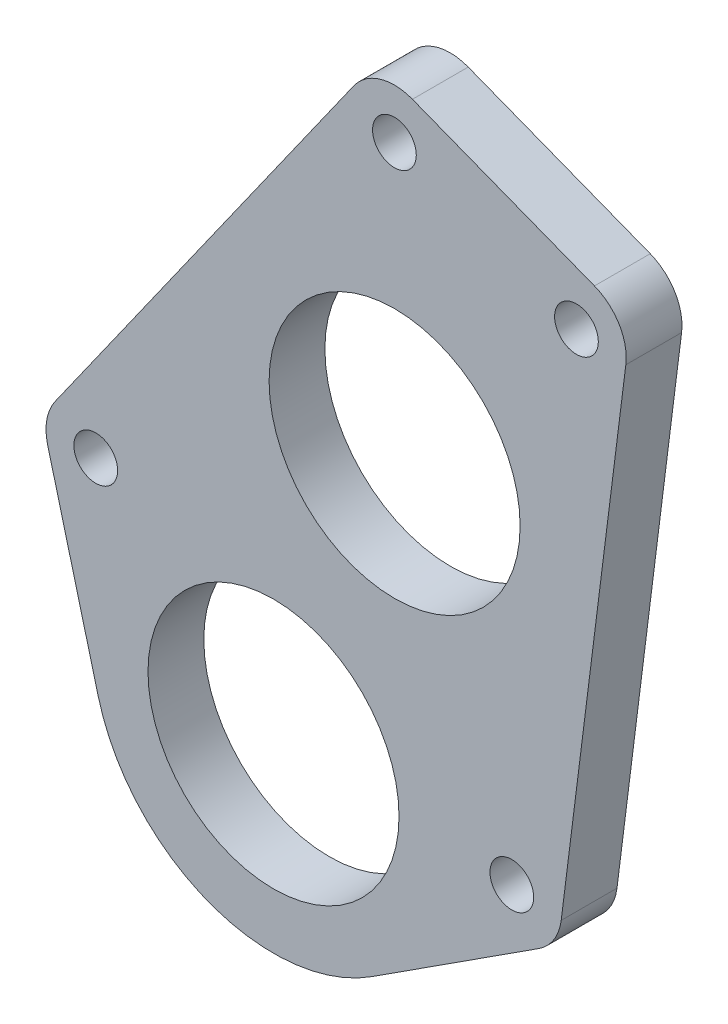
from build123d import *

# Parameters (mm, degrees)
SKETCH1_R           = 14.2875
SKETCH1_R_2         = 2.4892
BOSS_EXTRUDE1_DEPTH = 3.175


with BuildPart() as part:
    # Sketch1 → Boss-Extrude1 (new, symmetric)
    with BuildSketch(Plane.XY):
        with BuildLine():
            Line((-25.711392616, 16.628788534), (-19.959064153, -5.248062916))
            ThreePointArc((-19.959064153, -5.248062916), (-7.46638511, -19.239529611), (11.194044807, -17.337813216))
            Line((11.194044807, -17.337813216), (30.197779716, -5.06817705))
            ThreePointArc((30.197779716, -5.06817705), (31.920407951, -3.32482419), (32.745305623, -1.016952645))
            Line((32.745305623, -1.016952645), (40.101774659, 57.430780584))
            ThreePointArc((40.101774659, 57.430780584), (39.346823469, 61.039121897), (36.531149536, 63.418629963))
            Line((36.531149536, 63.418629963), (15.81165611, 71.45935239))
            ThreePointArc((15.81165611, 71.45935239), (12.127948288, 71.602093471), (9.136585146, 69.447603998))
            Line((9.136585146, 69.447603998), (-24.859232582, 21.337942461))
            ThreePointArc((-24.859232582, 21.337942461), (-25.807074786, 19.077782645), (-25.711392616, 16.628788534))
        make_face()
        Circle(SKETCH1_R, mode=Mode.SUBTRACT)
        with Locations((13.784095588, 35.519131589)):
            Circle(SKETCH1_R, mode=Mode.SUBTRACT)
        with Locations((-20.233397162, 18.069179956)):
            Circle(SKETCH1_R_2, mode=Mode.SUBTRACT)
        with Locations((27.125444956, -0.309614161)):
            Circle(SKETCH1_R_2, mode=Mode.SUBTRACT)
        with Locations((34.481913992, 58.138119067)):
            Circle(SKETCH1_R_2, mode=Mode.SUBTRACT)
        with Locations((13.762420566, 66.178841494)):
            Circle(SKETCH1_R_2, mode=Mode.SUBTRACT)
    extrude(amount=BOSS_EXTRUDE1_DEPTH, both=True)


solid = part.part
